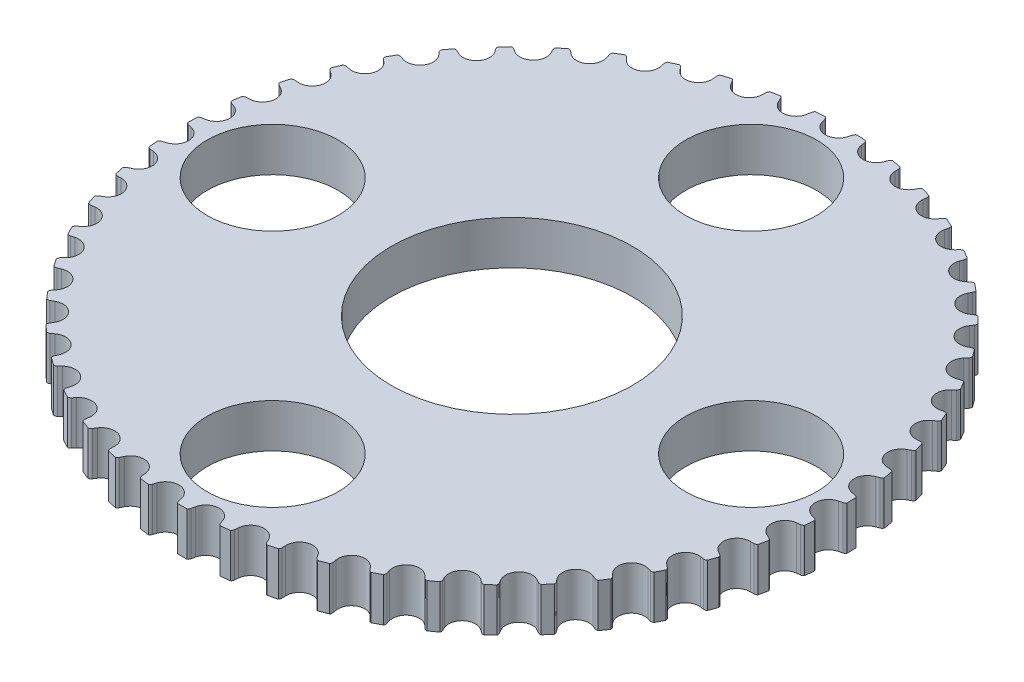
from build123d import *

# Parameters (mm, degrees)
SKETCH1_R          = 23.969707072
TOOTHOD_DEPTH      = 1.5875
TOOTHPROFILE_DEPTH = 35.046649457
TOOTHPATTERN_COUNT = 51
SKETCH13_R         = 8.76935
CUT_EXTRUDE2_DEPTH = 35.044290556
CIRPATTERN1_COUNT  = 4


with BuildPart() as part:
    # Sketch1 → ToothOD (new, symmetric)
    with BuildSketch(Plane(origin=(0, 0, 0), x_dir=(1, 0, 0), z_dir=(0, 1, 0))):
        Circle(SKETCH1_R)
    extrude(amount=TOOTHOD_DEPTH, both=True)

    # Sketch2 → ToothProfile (cut, through all)
    with BuildSketch(Plane(origin=(0, 1.5875, 0), x_dir=(1, 0, 0), z_dir=(0, 1, 0))):
        with BuildLine():
            ThreePointArc((-0.937033068, 23.519769068), (-0.590385173, 23.001594458), (0, 22.801307072))
            ThreePointArc((0, 22.801307072), (0.590385173, 23.001594458), (0.937033068, 23.519769068))
            ThreePointArc((0.937033068, 23.519769068), (0.971699064, 23.64588053), (1.007805813, 23.771587072))
            ThreePointArc((1.007805813, 23.771587072), (1.05732336, 23.869272918), (1.138629252, 23.942647735))
            ThreePointArc((1.138629252, 23.942647735), (0, 23.969707072), (-1.138629252, 23.942647735))
            ThreePointArc((-1.138629252, 23.942647735), (-1.05732336, 23.869272918), (-1.007805813, 23.771587072))
            ThreePointArc((-1.007805813, 23.771587072), (-0.971699064, 23.64588053), (-0.937033068, 23.519769068))
        make_face()
    toothprofile = extrude(amount=-TOOTHPROFILE_DEPTH, mode=Mode.SUBTRACT)

    # ToothPattern: ToothProfile ×51 about axis
    toothpattern_axis = Axis((0, 1.5875, 0), (0, -1, 0))
    for i in range(1, TOOTHPATTERN_COUNT):
        add(toothprofile.rotate(toothpattern_axis, i * 360 / TOOTHPATTERN_COUNT), mode=Mode.SUBTRACT)

    # Sketch13 → Cut-Extrude2 (cut, through all)
    with BuildSketch(Plane(origin=(0, 1.5875, 0), x_dir=(1, 0, 0), z_dir=(0, 1, 0))):
        Circle(SKETCH13_R)
        with BuildLine():
            ThreePointArc((-3.81, 20.2565), (0, 12.6365), (3.81, 20.2565))
            ThreePointArc((3.81, 20.2565), (0, 22.1615), (-3.81, 20.2565))
        make_face()
    cut_extrude2 = extrude(amount=-CUT_EXTRUDE2_DEPTH, mode=Mode.SUBTRACT)

    # CirPattern1: Cut-Extrude2 ×4 about axis
    cirpattern1_axis = Axis((0, -1.5875, 0), (0, 1, 0))
    for i in range(1, CIRPATTERN1_COUNT):
        add(cut_extrude2.rotate(cirpattern1_axis, i * 360 / CIRPATTERN1_COUNT), mode=Mode.SUBTRACT)


solid = part.part
